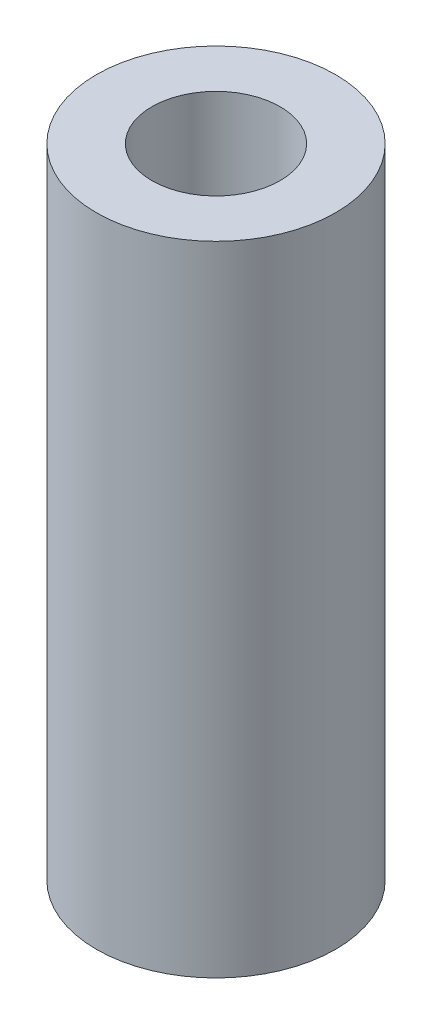
from build123d import *

# Parameters (mm, degrees)
SKETCH1_R           = 4.7625
SKETCH1_R_2         = 2.5527
BOSS_EXTRUDE1_DEPTH = 25.4


with BuildPart() as part:
    # Sketch1 → Boss-Extrude1 (new body)
    with BuildSketch(Plane(origin=(0, 0, 0), x_dir=(1, 0, 0), z_dir=(0, 1, 0))):
        Circle(SKETCH1_R)
        Circle(SKETCH1_R_2, mode=Mode.SUBTRACT)
    extrude(amount=BOSS_EXTRUDE1_DEPTH)


solid = part.part
